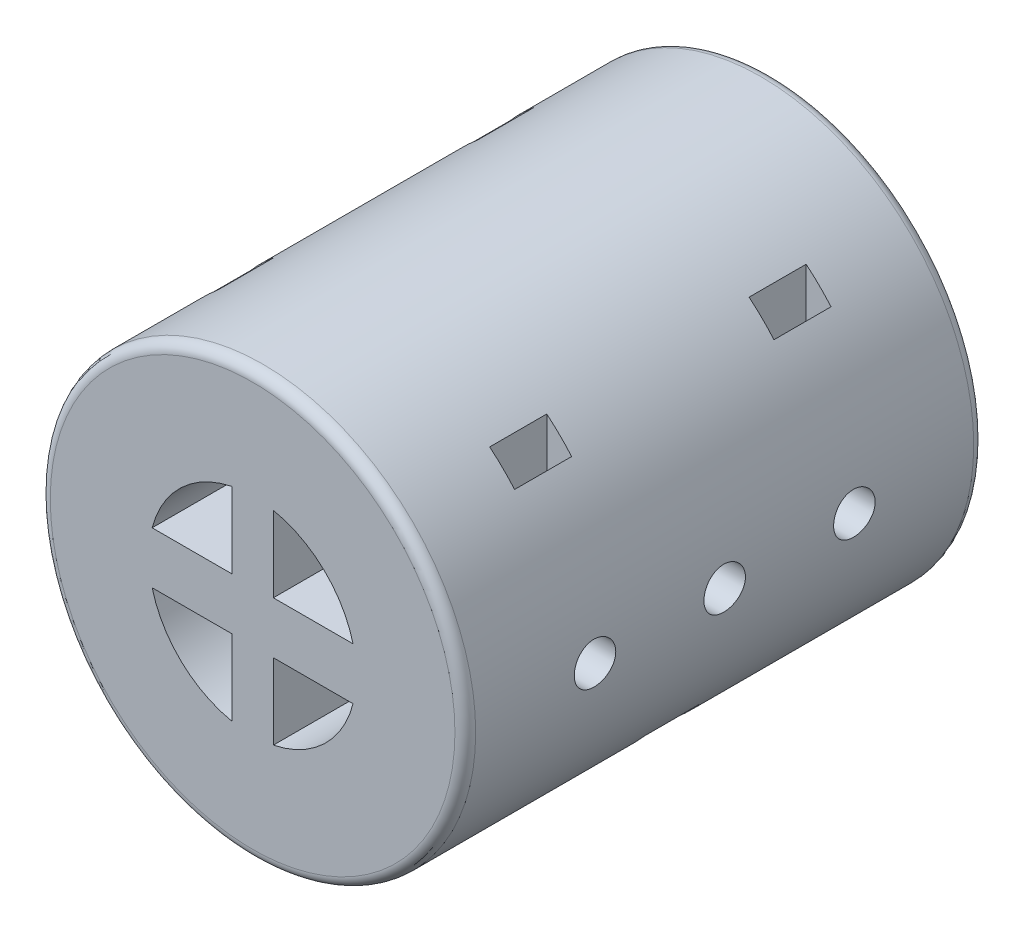
from build123d import *

# Parameters (mm, degrees)
SKETCH_1_R           = 20.5
EXTRUDE_1_DEPTH      = 50
FILLET_1_R           = 1
FILLET_2_R           = 1
SKETCH_2_R           = 2
CUT_EXTRUDE_1_DEPTH  = 68.832514358
CUT_EXTRUDE_START    = -5
CUT_EXTRUDE_2_DEPTH  = 2.4
CUT_EXTRUDE_9_DEPTH  = 58.79705882
SKETCH_6_W           = 2.4
SKETCH_6_H           = 5.5
CUT_EXTRUDE_10_DEPTH = 20.5
CUT_EXTRUDE_START_2  = -20.5
SKETCH_6_5_W         = 2.4
SKETCH_6_5_H         = 5.5
CUT_EXTRUDE_11_DEPTH = 20.5


with BuildPart() as part:
    # Эскиз1 → Бобышка-Вытянуть1 (new body)
    with BuildSketch(Plane.XY):
        Circle(SKETCH_1_R)
    extrude(amount=EXTRUDE_1_DEPTH)

    # Скругление1
    fillet_1_edges = [part.edges().sort_by_distance(p)[0] for p in [
        (-20.5, 0, 50),
    ]]
    fillet(fillet_1_edges, radius=FILLET_1_R)

    # Скругление2
    fillet_2_edges = [part.edges().sort_by_distance(p)[0] for p in [
        (-20.5, 0, 0),
    ]]
    fillet(fillet_2_edges, radius=FILLET_2_R)

    # Эскиз2 → Вырез-Вытянуть1 (cut, through all)
    with BuildSketch(Plane(origin=(20.5, 0, 0), x_dir=(0, 0, -1), z_dir=(1, 0, 0))):
        with Locations((-37.5, 0)):
            Circle(SKETCH_2_R)
        with Locations((-25, 0)):
            Circle(SKETCH_2_R)
        with Locations((-12.5, 0)):
            Circle(SKETCH_2_R)
    extrude(amount=-CUT_EXTRUDE_1_DEPTH, mode=Mode.SUBTRACT)

    # Эскиз3 → Вырез-Вытянуть2 (cut)
    with BuildSketch(Plane(origin=(20.5, 0, 0), x_dir=(0, 0, -1), z_dir=(1, 0, 0)).offset(CUT_EXTRUDE_START)):
        Polygon((-25, 3.175426481), (-27.75, 1.58771324), (-27.75, -1.58771324), (-25, -3.175426481), (-22.25, -1.58771324), (-22.25, 1.58771324), align=None)
        Polygon((-37.5, 3.175426481), (-40.25, 1.58771324), (-40.25, -1.58771324), (-37.5, -3.175426481), (-34.75, -1.58771324), (-34.75, 1.58771324), align=None)
        Polygon((-12.5, 3.175426481), (-15.25, 1.58771324), (-15.25, -1.58771324), (-12.5, -3.175426481), (-9.75, -1.58771324), (-9.75, 1.58771324), align=None)
    cut_extrude_2 = extrude(amount=-CUT_EXTRUDE_2_DEPTH, mode=Mode.SUBTRACT)

    # Зеркальное отражение1: Вырез-Вытянуть2 across plane
    add(cut_extrude_2.mirror(Plane(origin=(0, 0, 0), x_dir=(0, 0, 1), z_dir=(1, 0, 0))), mode=Mode.SUBTRACT)

    # Эскиз4 → Вырез-Вытянуть9 (cut, through all)
    with BuildSketch(Plane.XY.offset(50)):
        with BuildLine():
            Line((2, 9.797958971), (2, 2.5))
            Line((2, 2.5), (9.682458366, 2.5))
            ThreePointArc((9.682458366, 2.5), (6.887307867, 7.250171746), (2, 9.797958971))
        make_face()
        with BuildLine():
            Line((-2, 2.5), (-2, 9.797958971))
            ThreePointArc((-2, 9.797958971), (-6.887307867, 7.250171746), (-9.682458366, 2.5))
            Line((-9.682458366, 2.5), (-2, 2.5))
        make_face()
        with BuildLine():
            ThreePointArc((2, -9.797958971), (6.887307867, -7.250171746), (9.682458366, -2.5))
            Line((9.682458366, -2.5), (2, -2.5))
            Line((2, -2.5), (2, -9.797958971))
        make_face()
        with BuildLine():
            Line((-2, -2.5), (-9.682458366, -2.5))
            ThreePointArc((-9.682458366, -2.5), (-6.887307867, -7.250171746), (-2, -9.797958971))
            Line((-2, -9.797958971), (-2, -2.5))
        make_face()
    extrude(amount=-CUT_EXTRUDE_9_DEPTH, mode=Mode.SUBTRACT)

    # Эскиз6 → Вырез-Вытянуть10 (cut)
    with BuildSketch(Plane(origin=(0, 20.5, 0), x_dir=(1, 0, 0), z_dir=(0, 1, 0))):
        with Locations((14.3, -37.5)):
            Rectangle(SKETCH_6_W, SKETCH_6_H)
        with Locations((14.3, -12.5)):
            Rectangle(SKETCH_6_W, SKETCH_6_H)
    cut_extrude_10 = extrude(amount=-CUT_EXTRUDE_10_DEPTH, mode=Mode.SUBTRACT)

    # Эскиз6<5> → Вырез-Вытянуть11 (cut)
    with BuildSketch(Plane(origin=(0, 20.5, 0), x_dir=(1, 0, 0), z_dir=(0, 1, 0)).offset(CUT_EXTRUDE_START_2)):
        with Locations((14.3, -25)):
            Rectangle(SKETCH_6_5_W, SKETCH_6_5_H)
    cut_extrude_11 = extrude(amount=-CUT_EXTRUDE_11_DEPTH, mode=Mode.SUBTRACT)

    # Зеркальное отражение2: Вырез-Вытянуть10, Вырез-Вытянуть11 across plane
    add(cut_extrude_10.mirror(Plane(origin=(0, 0, 0), x_dir=(0, 0, 1), z_dir=(1, 0, 0))), mode=Mode.SUBTRACT)
    add(cut_extrude_11.mirror(Plane(origin=(0, 0, 0), x_dir=(0, 0, 1), z_dir=(1, 0, 0))), mode=Mode.SUBTRACT)


solid = part.part
